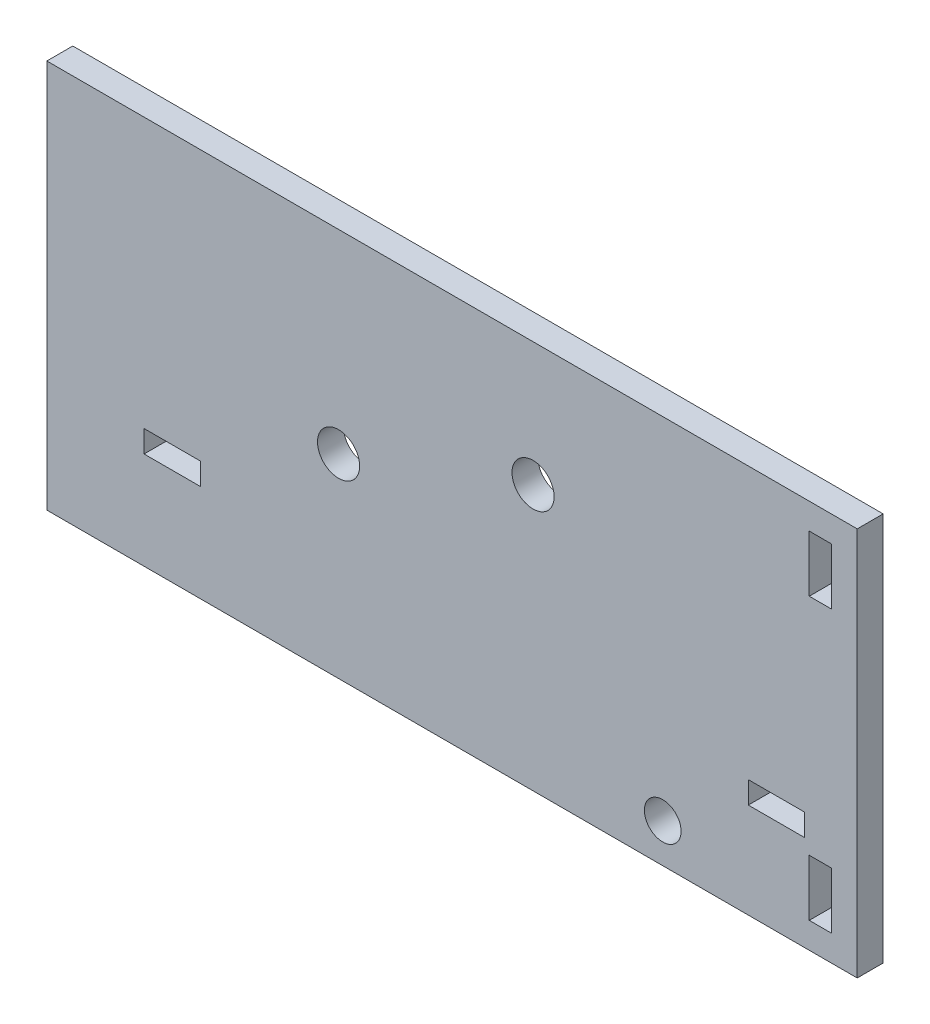
from build123d import *

# Parameters (mm, degrees)
SKETCH1_W               = 121
SKETCH1_H               = 60
SKETCH1_R               = 3.25
SKETCH1_R_2             = 2.83
SKETCH1_W_2             = 8.7
SKETCH1_H_2             = 3.4
BOSS_EXTRUDE1_DEPTH     = 4
SKETCH2_W               = 4
SKETCH2_H               = 60
BOSS_EXTRUDE2_DEPTH     = 4
CUT_EXTRUDE2_DEPTH      = 90.374962565
CUT_EXTRUDE2_DEPTH_BACK = 90.374962565
SKETCH3_W               = 3.4
SKETCH3_H               = 8.7


with BuildPart() as part:
    # Sketch1 → Boss-Extrude1 (new body)
    with BuildSketch(Plane.XY):
        with Locations((-18.5, 11.603893248)):
            Rectangle(SKETCH1_W, SKETCH1_H)
        with Locations((-34, 11.603893248)):
            Circle(SKETCH1_R, mode=Mode.SUBTRACT)
        with Locations((-4, 22.5)):
            Circle(SKETCH1_R, mode=Mode.SUBTRACT)
        with Locations((16, -12.396106752)):
            Circle(SKETCH1_R_2, mode=Mode.SUBTRACT)
        with Locations((-59.65, -1.696106752)):
            Rectangle(SKETCH1_W_2, SKETCH1_H_2, mode=Mode.SUBTRACT)
        with Locations((33.55, -1.996106752)):
            Rectangle(SKETCH1_W_2, SKETCH1_H_2, mode=Mode.SUBTRACT)
    extrude(amount=BOSS_EXTRUDE1_DEPTH)

    # Sketch2 → Boss-Extrude2 (add)
    with BuildSketch(Plane.XY):
        with Locations((44, 11.603893248)):
            Rectangle(SKETCH2_W, SKETCH2_H)
    extrude(amount=BOSS_EXTRUDE2_DEPTH)

    # Sketch3 → Cut-Extrude2 (cut, two sides: drawn at the far end of the back side and taken through both)
    with BuildSketch(Plane.XY.offset(-CUT_EXTRUDE2_DEPTH_BACK)):
        with Locations((40.3, 33.253893248)):
            Rectangle(SKETCH3_W, SKETCH3_H)
        with Locations((40.3, -10.046106752)):
            Rectangle(SKETCH3_W, SKETCH3_H)
    extrude(amount=CUT_EXTRUDE2_DEPTH + CUT_EXTRUDE2_DEPTH_BACK, mode=Mode.SUBTRACT)


solid = part.part
